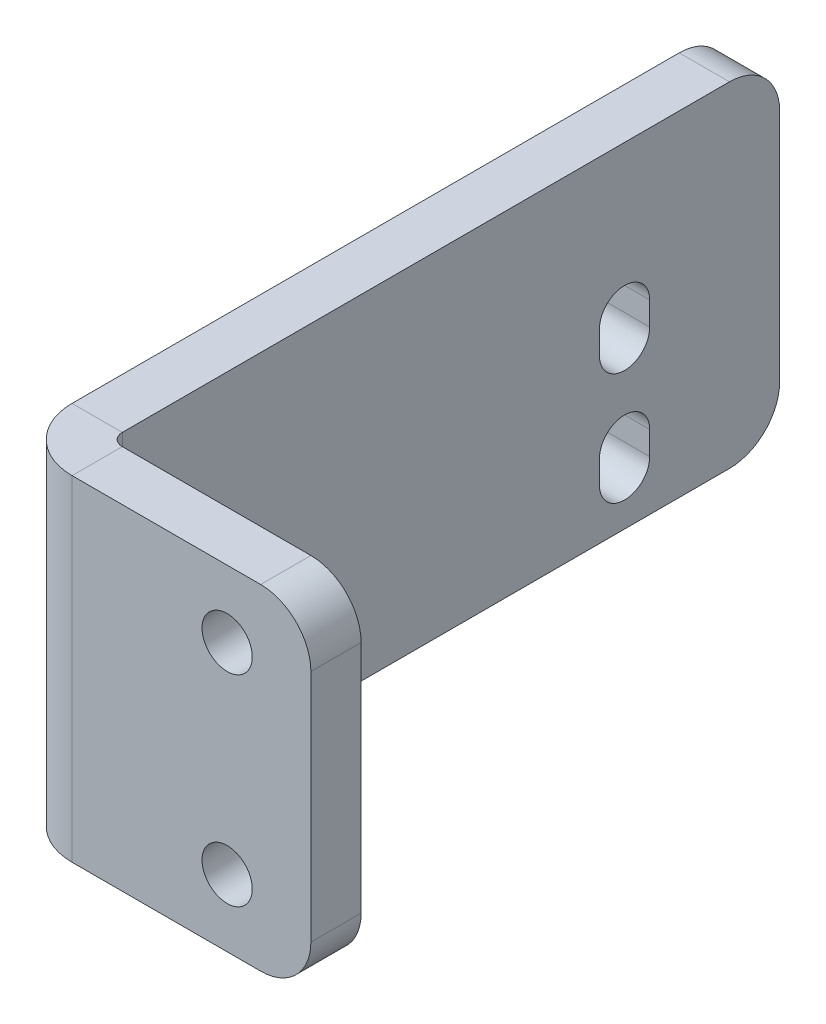
from build123d import *

# Parameters (mm, degrees)
BASE_FLANGE1_DEPTH = 20
CUT_EXTRUDE1_REACH = 48.393
SKETCH6_R          = 1.5
FILLET1_R          = 3
FILLET2_R          = 3
CUT_EXTRUDE4_DEPTH = 85.132737956


# Sheet-metal steps are written as plain solids
with BuildPart() as part:
    # Sketch1 → Base-Flange1 (new body)
    with BuildSketch(Plane(origin=(0, 0, 0), x_dir=(1, 0, 0), z_dir=(0, 1, 0))):
        with BuildLine():
            Line((-9.340010949, 80.332543816), (-9.340010949, 41.069143816))
            ThreePointArc((-9.340010949, 41.069143816), (-9.124265804, 40.548288961), (-8.603410949, 40.332543816))
            Line((-8.603410949, 40.332543816), (5.659989051, 40.332543816))
            Line((5.659989051, 40.332543816), (5.659989051, 37.332543816))
            Line((5.659989051, 37.332543816), (-8.603410949, 37.332543816))
            ThreePointArc((-8.603410949, 37.332543816), (-11.245586147, 38.426968618), (-12.340010949, 41.069143816))
            Line((-12.340010949, 41.069143816), (-12.340010949, 80.332543816))
            Line((-12.340010949, 80.332543816), (-9.340010949, 80.332543816))
        make_face()
    extrude(amount=BASE_FLANGE1_DEPTH)

    # Sketch6 → Cut-Extrude1 (cut, up to next)
    with BuildSketch(Plane(origin=(0, 0, -40.332543816), x_dir=(-1, 0, 0), z_dir=(0, 0, -1)), mode=Mode.PRIVATE) as cut_extrude1_sk1:
        with Locations((-0.659989051, 16)):
            Circle(SKETCH6_R)
    cut_extrude1_tool1 = extrude(cut_extrude1_sk1.sketch, amount=-CUT_EXTRUDE1_REACH, mode=Mode.PRIVATE) & part.part
    # Sketch6 → Cut-Extrude1 (cut, up to next)
    with BuildSketch(Plane(origin=(0, 0, -40.332543816), x_dir=(-1, 0, 0), z_dir=(0, 0, -1)), mode=Mode.PRIVATE) as cut_extrude1_sk2:
        with Locations((-0.659989051, 4)):
            Circle(SKETCH6_R)
    cut_extrude1_tool2 = extrude(cut_extrude1_sk2.sketch, amount=-CUT_EXTRUDE1_REACH, mode=Mode.PRIVATE) & part.part
    add(cut_extrude1_tool1.solids().sort_by_distance((0.659989, 16, -40.332544))[0], mode=Mode.SUBTRACT)
    add(cut_extrude1_tool2.solids().sort_by_distance((0.659989, 4, -40.332544))[0], mode=Mode.SUBTRACT)

    # Fillet1
    fillet1_edges = [part.edges().sort_by_distance(p)[0] for p in [
        (5.659989051, 20, -38.832543816),
        (5.659989051, 0, -38.832543816),
    ]]
    fillet(fillet1_edges, radius=FILLET1_R)

    # Fillet2
    fillet2_edges = [part.edges().sort_by_distance(p)[0] for p in [
        (-10.840010949, 20, -80.332543816),
        (-10.840010949, 0, -80.332543816),
    ]]
    fillet(fillet2_edges, radius=FILLET2_R)

    # Sketch7 → Cut-Extrude4 (cut, through all)
    with BuildSketch(Plane(origin=(-9.340010949, 0, 0), x_dir=(0, 0, -1), z_dir=(1, 0, 0))):
        with BuildLine():
            Line((72.569143816, 11.1), (72.569143816, 9.7))
            ThreePointArc((72.569143816, 9.7), (71.069143816, 8.2), (69.569143816, 9.7))
            Line((69.569143816, 9.7), (69.569143816, 11.1))
            ThreePointArc((69.569143816, 11.1), (71.069143816, 12.6), (72.569143816, 11.1))
        make_face()
        with BuildLine():
            Line((72.569143816, 4.4), (72.569143816, 3))
            ThreePointArc((72.569143816, 3), (71.069143816, 1.5), (69.569143816, 3))
            Line((69.569143816, 3), (69.569143816, 4.4))
            ThreePointArc((69.569143816, 4.4), (71.069143816, 5.9), (72.569143816, 4.4))
        make_face()
    extrude(amount=-CUT_EXTRUDE4_DEPTH, mode=Mode.SUBTRACT)


solid = part.part
